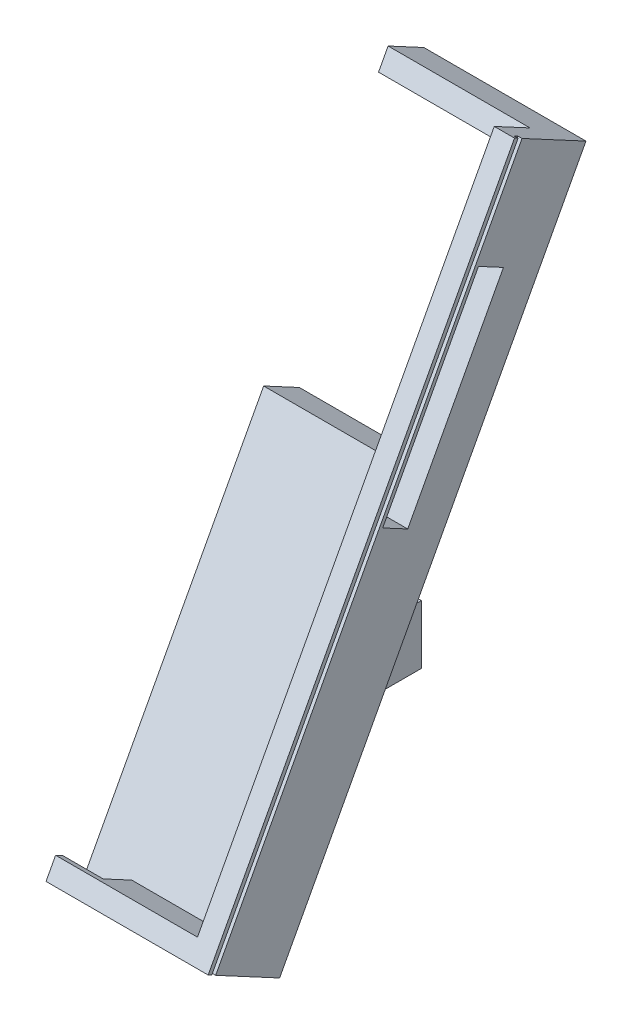
from build123d import *

# Parameters (mm, degrees)
SKETCH_1_W               = 39.5
SKETCH_1_H               = 14.5
EXTRUDE_1_DEPTH          = 40
SKETCH_6_W               = 80
SKETCH_6_H               = 160
EXTRUDE_2_DEPTH          = 10
EXTRUDE_3_DEPTH          = 10
SKETCH_8_W               = 60
SKETCH_8_H               = 60
CUT_EXTRUDE_1_DEPTH      = 10
SKETCH_9_W               = 20
SKETCH_9_H               = 8
CUT_EXTRUDE_3_DEPTH      = 10
CUT_EXTRUDE_4_DEPTH      = 158.764612799
CUT_EXTRUDE_4_DEPTH_BACK = 1
CUT_EXTRUDE_5_DEPTH      = 1
SKETCH_13_W              = 181.699719832
SKETCH_13_H              = 160.542903139
CUT_EXTRUDE_7_DEPTH      = 40
CUT_EXTRUDE_8_DEPTH      = 40


with BuildPart() as part:
    # 草图1 → 凸台-拉伸1 (new body)
    with BuildSketch(Plane.XY):
        Rectangle(SKETCH_1_W, SKETCH_1_H)
    extrude(amount=EXTRUDE_1_DEPTH)

    # 草图6 → 凸台-拉伸2 (add)
    with BuildSketch(Plane(origin=(0, 15.03668382, 28.054947672), x_dir=(1, 0, 0), z_dir=(0, 0.4723983215829414, 0.8813851744643881))):
        with Locations((0, 22.485349826)):
            Rectangle(SKETCH_6_W, SKETCH_6_H)
    extrude(amount=EXTRUDE_2_DEPTH)

    # 草图7 → 凸台-拉伸3 (add)
    with BuildSketch(Plane(origin=(0, 19.760667036, 36.868799416), x_dir=(1, 0, 0), z_dir=(0, 0.4723983215829416, 0.881385174464388))):
        Polygon((-35, -52.514650174), (35, -52.514650174), (35, 102.485349826), (40, 102.485349826), (40, -57.514650174), (-40, -57.514650174), (-40, 102.485349826), (-35, 102.485349826), align=None)
    extrude(amount=EXTRUDE_3_DEPTH)

    # 草图8 → 切除-拉伸1 (cut)
    with BuildSketch(Plane(origin=(0, 19.760667036, 36.868799416), x_dir=(1, 0, 0), z_dir=(0, 0.47239832158294137, 0.8813851744643881))):
        with Locations((0, 67.485349826)):
            Rectangle(SKETCH_8_W, SKETCH_8_H)
    extrude(amount=-CUT_EXTRUDE_1_DEPTH, mode=Mode.SUBTRACT)

    # 草图9 → 切除-拉伸3 (cut)
    with BuildSketch(Plane(origin=(0, -50.692559978, 27.169824208), x_dir=(1, 0, 0), z_dir=(0, -0.881385174464388, 0.47239832158294154))):
        with Locations((-0.027304515, 45.830519147)):
            Rectangle(SKETCH_9_W, SKETCH_9_H)
    extrude(amount=-CUT_EXTRUDE_3_DEPTH, mode=Mode.SUBTRACT)

    # 草图10 → 切除-拉伸4 (cut, two sides: drawn at the far end of the back side and taken through both)
    with BuildSketch(Plane.ZY.offset(40).offset(-CUT_EXTRUDE_4_DEPTH_BACK)):
        Polygon((235.352563611, -333.840604393), (71.001566503, -27.199946201), (-4.58216495, 113.821681713), (-3.612641258, 114.341319867), (71.971090195, -26.680308047), (236.322087302, -333.320966239), (565.024081517, -946.602282623), (564.054557825, -947.121920777), align=None)
    extrude(amount=CUT_EXTRUDE_4_DEPTH + CUT_EXTRUDE_4_DEPTH_BACK, mode=Mode.SUBTRACT)

    # 草图11 → 切除-拉伸5 (cut)
    with BuildSketch(Plane(origin=(40, 0, 0), x_dir=(0, 0, -1), z_dir=(1, 0, 0))):
        Polygon((3.612641258, 114.341319867), (-71.971090195, -26.680308047), (-71.001566503, -27.199946201), (4.58216495, 113.821681713), align=None)
    extrude(amount=-CUT_EXTRUDE_5_DEPTH, mode=Mode.SUBTRACT)

    # 草图13 → 切除-拉伸7 (cut)
    with BuildSketch(Plane.ZY.offset(40)):
        with Locations((21.890942697, 37.608433187)):
            Rectangle(SKETCH_13_W, SKETCH_13_H)
    extrude(amount=-CUT_EXTRUDE_7_DEPTH, mode=Mode.SUBTRACT)

    # 草图14 → 切除-拉伸8 (cut)
    with BuildSketch(Plane.ZY.offset(-35)):
        Polygon((0, 88.549254381), (6.169696221, 91.856042632), (29.7896123, 47.786783909), (23.619916079, 44.479995658), align=None)
    extrude(amount=-CUT_EXTRUDE_8_DEPTH, mode=Mode.SUBTRACT)


solid = part.part
